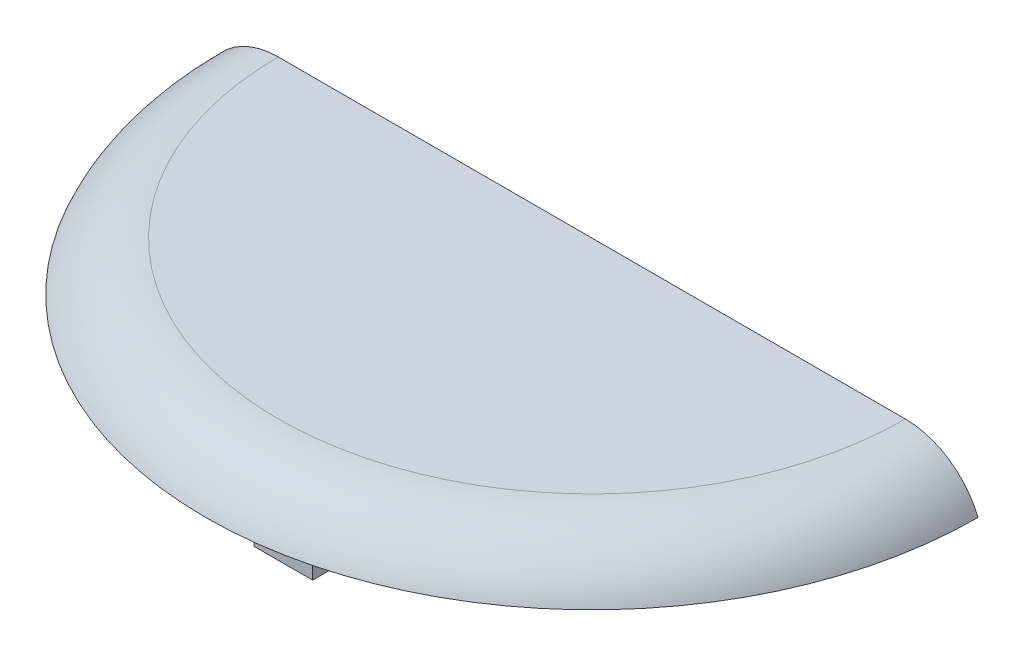
from build123d import *

# Parameters (mm, degrees)
CUT_EXTRUDE3_DEPTH           = 60
CUT_EXTRUDE5_DEPTH           = 2
CUT_EXTRUDE5_DEPTH_BACK      = 30
SKETCH9_R                    = 38
SKETCH9_R_2                  = 23
SKETCH19_W                   = 12
SKETCH19_H                   = 36.5
CUT_REVOLVE2_ANGLE           = 65
CUT_REVOLVE2_OTHER_WAY_ANGLE = 65
SKETCH21_W                   = 3.25
SKETCH21_H                   = 4
BOSS_EXTRUDE3_DEPTH          = 1.35
CIRPATTERN1_COUNT            = 5
CUT_EXTRUDE9_START           = -5
CUT_EXTRUDE9_DEPTH           = 5
SKETCH23_R                   = 10.5
CUT_EXTRUDE10_DEPTH          = 10
SKETCH24_W                   = 15
SKETCH24_H                   = 8
BOSS_EXTRUDE4_DEPTH          = 8
SKETCH26_W                   = 10
SKETCH26_H                   = 6
CUT_EXTRUDE11_DEPTH          = 10
SKETCH27_W                   = 4
SKETCH27_H                   = 5
CUT_EXTRUDE12_DEPTH          = 5
CUT_EXTRUDE14_DEPTH          = 2
CUT_EXTRUDE14_DEPTH_BACK     = 30
SKETCH29_R                   = 1
CUT_EXTRUDE15_DEPTH          = 15
FILLET1_R                    = 6
FILLET2_R                    = 8
INTERSECT1_DEPTH             = 58.427876097
SKETCH31_W                   = 6
SKETCH31_H                   = 3
BOSS_EXTRUDE7_DEPTH          = 8
SKETCH32_R                   = 1
CUT_EXTRUDE16_DEPTH          = 7.5


# Read off the part's stored shape, not the designer's step: Cut-Extrude9, Intersect1
with BuildPart() as part:
    # Sketch1 → Revolve1 (revolve)
    with BuildSketch(Plane.XY, mode=Mode.PRIVATE) as revolve1_sk:
        with BuildLine():
            Line((0, 63.427876097), (32, 63.427876097))
            ThreePointArc((32, 63.427876097), (37.656854249, 61.084730346), (40, 55.427876097))
            Line((40, 55.427876097), (40, 28.846818009))
            ThreePointArc((40, 28.846818009), (38.792081772, 24.082439968), (35.460140376, 20.469057744))
            Line((35.460140376, 20.469057744), (28.539859624, 15.958818353))
            ThreePointArc((28.539859624, 15.958818353), (25.207918228, 12.345436129), (24, 7.581058088))
            Line((24, 7.581058088), (24, 3.25))
            Line((24, 3.25), (24.35, 3))
            Line((24.35, 3), (24.35, 0))
            Line((24.35, 0), (22.5, 0))
            Line((22.5, 0), (22.5, 12.5))
            ThreePointArc((22.5, 12.5), (22.353553391, 12.853553391), (22, 13))
            Line((22, 13), (0, 13))
            Line((0, 13), (0, 63.427876097))
        make_face()
    revolve(revolve1_sk.sketch.rotate(Axis((0, 0, 0), (0, 1, 0)), 90), axis=Axis((0, 0, 0), (0, 1, 0)))

    # Sketch11 → Cut-Extrude3 (cut)
    with BuildSketch(Plane(origin=(0, 13, 0), x_dir=(-1, 0, 0), z_dir=(0, -1, 0))):
        with BuildLine():
            Line((-21, 0), (21, 0))
            ThreePointArc((21, 0), (0, 21), (-21, 0))
        make_face()
    extrude(amount=-CUT_EXTRUDE3_DEPTH, mode=Mode.SUBTRACT)

    # Sketch9 → Cut-Extrude5 (cut, two sides: drawn at the far end of the back side and taken through both)
    with BuildSketch(Plane(origin=(0, 55.427876097, 0), x_dir=(1, 0, 0), z_dir=(0, 1, 0)).offset(-CUT_EXTRUDE5_DEPTH_BACK)):
        with Locations(Location((0, 0, 0), (0, 0, 270))):
            Circle(SKETCH9_R)
        with Locations(Location((0, 0, 0), (0, 0, 270))):
            Circle(SKETCH9_R_2, mode=Mode.SUBTRACT)
    extrude(amount=CUT_EXTRUDE5_DEPTH + CUT_EXTRUDE5_DEPTH_BACK, mode=Mode.SUBTRACT)

    # Sketch19 → Cut-Revolve2 (revolve, cut)
    with BuildSketch(Plane(origin=(0, 0, 0), x_dir=(0, 0, -1), z_dir=(1, 0, 0))):
        with Locations((-41.064715832, 37.177876097)):
            Rectangle(SKETCH19_W, SKETCH19_H)
    revolve(axis=Axis((0, 0, 0), (0, 1, 0)), revolution_arc=CUT_REVOLVE2_ANGLE, mode=Mode.SUBTRACT)

    # Sketch19 → Cut-Revolve2 other way (revolve, cut)
    with BuildSketch(Plane(origin=(0, 0, 0), x_dir=(0, 0, -1), z_dir=(1, 0, 0))):
        with Locations((-41.064715832, 37.177876097)):
            Rectangle(SKETCH19_W, SKETCH19_H)
    revolve(axis=Axis((0, 0, 0), (0, -1, 0)), revolution_arc=CUT_REVOLVE2_OTHER_WAY_ANGLE, mode=Mode.SUBTRACT)

    # Sketch21 → Boss-Extrude3 (add)
    with BuildSketch(Plane(origin=(0, 0, 22.5), x_dir=(-1, 0, 0), z_dir=(0, 0, -1))):
        with Locations((0, 2)):
            Rectangle(SKETCH21_W, SKETCH21_H)
    boss_extrude3 = extrude(amount=BOSS_EXTRUDE3_DEPTH)

    # CirPattern1: Boss-Extrude3 ×5 about axis
    cirpattern1_axis = Axis((0, 0, 0), (0, 1, 0))
    for i in range(1, CIRPATTERN1_COUNT):
        add(boss_extrude3.rotate(cirpattern1_axis, i * 360 / CIRPATTERN1_COUNT))

    # Cut-Extrude9 outline → Cut-Extrude9 (cut)
    with BuildSketch(Plane(origin=(0, 63.427876097, 0), x_dir=(1, 0, 0), z_dir=(0, 1, 0)).offset(CUT_EXTRUDE9_START)):
        with BuildLine():
            ThreePointArc((40, 0), (0, 40), (-40, 0))
            Line((-40, 0), (-21, 0))
            ThreePointArc((-21, 0), (0, 21), (21, 0))
            Line((21, 0), (40, 0))
        make_face()
    extrude(amount=CUT_EXTRUDE9_DEPTH, mode=Mode.SUBTRACT)

    # Sketch23 → Cut-Extrude10 (cut)
    with BuildSketch(Plane(origin=(0, 0, -40), x_dir=(-1, 0, 0), z_dir=(0, 0, -1))):
        with Locations((0, 42.137876097)):
            Circle(SKETCH23_R)
    extrude(amount=-CUT_EXTRUDE10_DEPTH, mode=Mode.SUBTRACT)

    # Sketch24 → Boss-Extrude4 (add)
    with BuildSketch(Plane(origin=(0, 58.427876097, 0), x_dir=(1, 0, 0), z_dir=(0, 1, 0))):
        with Locations((0, 30)):
            Rectangle(SKETCH24_W, SKETCH24_H)
    extrude(amount=-BOSS_EXTRUDE4_DEPTH)

    # Sketch26 → Cut-Extrude11 (cut)
    with BuildSketch(Plane(origin=(0, 58.427876097, 0), x_dir=(1, 0, 0), z_dir=(0, 1, 0))):
        with Locations((0, 30)):
            Rectangle(SKETCH26_W, SKETCH26_H)
    extrude(amount=-CUT_EXTRUDE11_DEPTH, mode=Mode.SUBTRACT)

    # Sketch27 → Cut-Extrude12 (cut)
    with BuildSketch(Plane(origin=(7.5, 0, 0), x_dir=(0, 0, -1), z_dir=(1, 0, 0))):
        with Locations((30, 53.927876097)):
            Rectangle(SKETCH27_W, SKETCH27_H)
    extrude(amount=-CUT_EXTRUDE12_DEPTH, mode=Mode.SUBTRACT)

    # Sketch28 → Cut-Extrude14 (cut, two sides: drawn at the far end of the back side and taken through both)
    with BuildSketch(Plane(origin=(0, 55.427876097, 0), x_dir=(1, 0, 0), z_dir=(0, 1, 0)).offset(-CUT_EXTRUDE14_DEPTH_BACK)):
        with BuildLine():
            Line((-22.912878475, -2), (22.912878475, -2))
            ThreePointArc((22.912878475, -2), (0, -23), (-22.912878475, -2))
        make_face()
    extrude(amount=CUT_EXTRUDE14_DEPTH + CUT_EXTRUDE14_DEPTH_BACK, mode=Mode.SUBTRACT)

    # Sketch29 → Cut-Extrude15 (cut)
    with BuildSketch(Plane(origin=(0, 0, 0), x_dir=(-1, 0, 0), z_dir=(0, 0, -1))):
        with Locations((-30.416198487, 60.927876097)):
            Circle(SKETCH29_R)
        with Locations((30.416198487, 60.927876097)):
            Circle(SKETCH29_R)
        with Locations((0, 60.927876097)):
            Circle(SKETCH29_R)
    extrude(amount=-CUT_EXTRUDE15_DEPTH, mode=Mode.SUBTRACT)

    # Fillet1
    fillet1_edges = [part.edges().sort_by_distance(p)[0] for p in [
        (21, 35.713938048, 0),
        (-21, 35.713938048, 0),
    ]]
    fillet(fillet1_edges, radius=FILLET1_R)

    # Fillet2
    fillet2_edges = [part.edges().sort_by_distance(p)[0] for p in [
        (-22.912878475, 41.427876097, 2),
        (22.912878475, 41.427876097, 2),
    ]]
    fillet(fillet2_edges, radius=FILLET2_R)

    # Intersect1 outline → Intersect1 (cut)
    with BuildSketch(Plane(origin=(0, 0, 0), x_dir=(1, 0, 0), z_dir=(0, 1, 0))):
        with BuildLine():
            Line((-37.508702776, -13.895942431), (-42, -15.355253362))
            Line((-42, -15.355253362), (-42, -41))
            Line((-42, -41), (42, -41))
            Line((42, -41), (42, -15.355253362))
            Line((42, -15.355253362), (37.508702776, -13.895942431))
            ThreePointArc((37.508702776, -13.895942431), (0, 40), (-37.508702776, -13.895942431))
        make_face()
        with BuildLine():
            ThreePointArc((19.246817919, 8.4), (18.767687244, 2.713664655), (13.747727085, 0))
            Line((13.747727085, 0), (-13.747727085, 0))
            ThreePointArc((-13.747727085, 0), (-18.767687244, 2.713664655), (-19.246817919, 8.4))
            ThreePointArc((-19.246817919, 8.4), (0, 21), (19.246817919, 8.4))
        make_face(mode=Mode.SUBTRACT)
    extrude(amount=INTERSECT1_DEPTH, mode=Mode.SUBTRACT)

    # Sketch31 → Boss-Extrude7 (add)
    with BuildSketch(Plane(origin=(0, 58.427876097, 0), x_dir=(1, 0, 0), z_dir=(0, 1, 0))):
        with Locations((0, -30)):
            Rectangle(SKETCH31_W, SKETCH31_H)
    extrude(amount=-BOSS_EXTRUDE7_DEPTH)

    # Sketch32 → Cut-Extrude16 (cut)
    with BuildSketch(Plane(origin=(3, 0, 0), x_dir=(0, 0, -1), z_dir=(1, 0, 0))):
        with Locations((-30, 54.427876097)):
            Circle(SKETCH32_R)
    extrude(amount=-CUT_EXTRUDE16_DEPTH, mode=Mode.SUBTRACT)


solid = part.part
